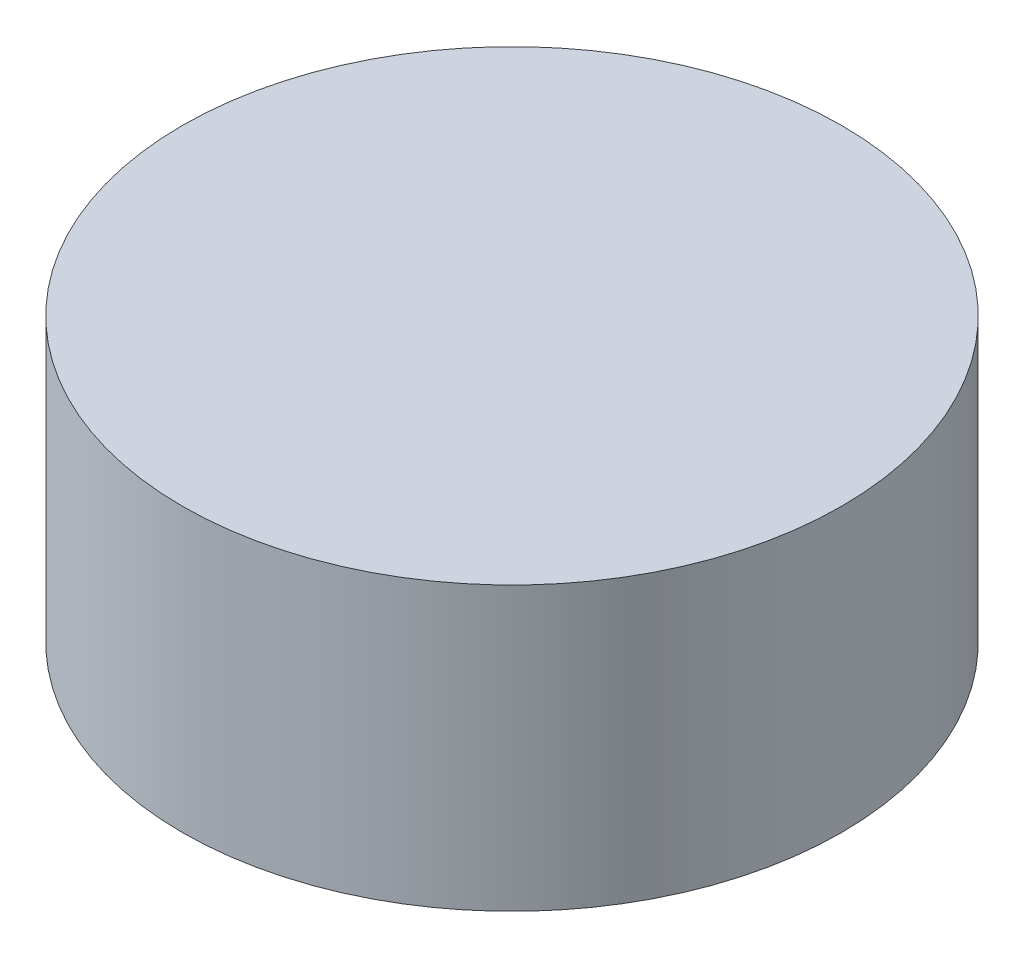
from build123d import *

# Parameters (mm, degrees)
SKETCH1_R           = 17.5
BOSS_EXTRUDE1_DEPTH = 7.5


with BuildPart() as part:
    # Sketch1 → Boss-Extrude1 (new, symmetric)
    with BuildSketch(Plane(origin=(0, 0, 0), x_dir=(1, 0, 0), z_dir=(0, 1, 0))):
        Circle(SKETCH1_R)
    extrude(amount=BOSS_EXTRUDE1_DEPTH, both=True)


solid = part.part
